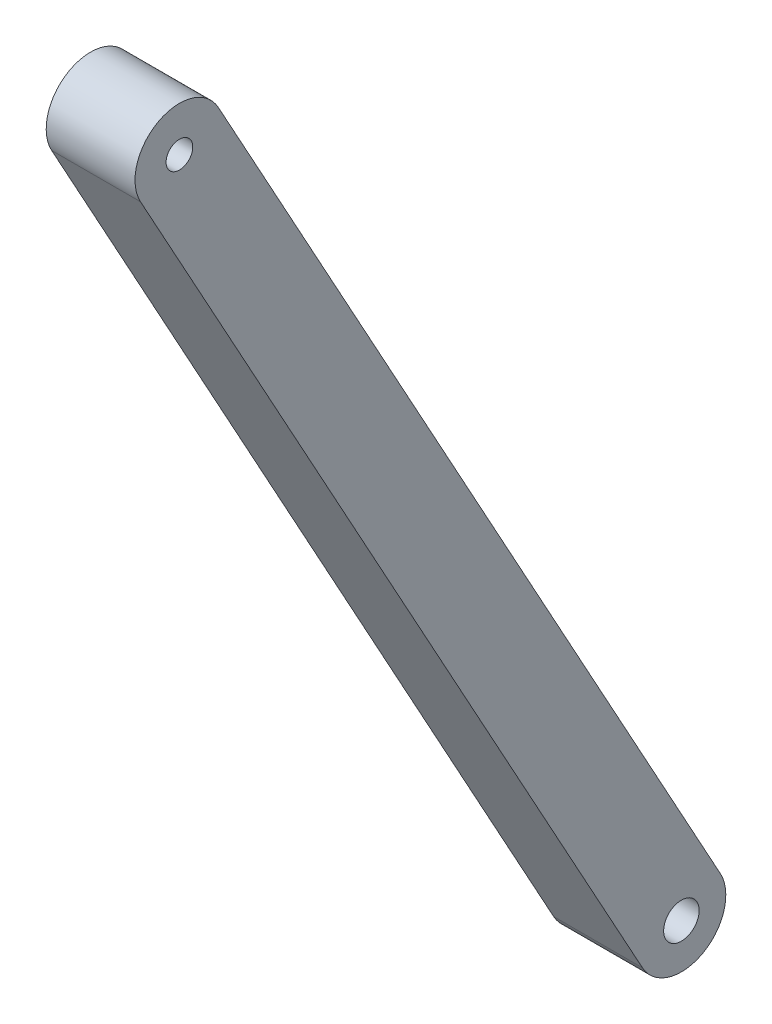
from build123d import *

# Parameters (mm, degrees)
BOSS_EXTRUDE1_DEPTH      = 5
BOSS_EXTRUDE1_DEPTH_BACK = 5
SKETCH3_R                = 1.5
SKETCH3_R_2              = 2


with BuildPart() as part:
    # Sketch3 → Boss-Extrude1 (new, two sides: drawn at the far end of the back side and taken through both)
    with BuildSketch(Plane(origin=(0, 0, 0), x_dir=(0, 0, -1), z_dir=(1, 0, 0)).offset(-BOSS_EXTRUDE1_DEPTH_BACK)):
        with BuildLine():
            Line((-125.376483123, 74.76890341), (-68.856906351, -28.189003934))
            ThreePointArc((-68.856906351, -28.189003934), (-70.833825943, -34.978097315), (-77.622919323, -33.001177724))
            Line((-77.622919323, -33.001177724), (-134.142496095, 69.956729621))
            ThreePointArc((-134.142496095, 69.956729621), (-132.165576504, 76.745823001), (-125.376483123, 74.76890341))
        make_face()
        with Locations((-129.759489609, 72.362816515)):
            Circle(SKETCH3_R, mode=Mode.SUBTRACT)
        with Locations((-73.239912837, -30.595090829)):
            Circle(SKETCH3_R_2, mode=Mode.SUBTRACT)
    extrude(amount=BOSS_EXTRUDE1_DEPTH + BOSS_EXTRUDE1_DEPTH_BACK)


solid = part.part
